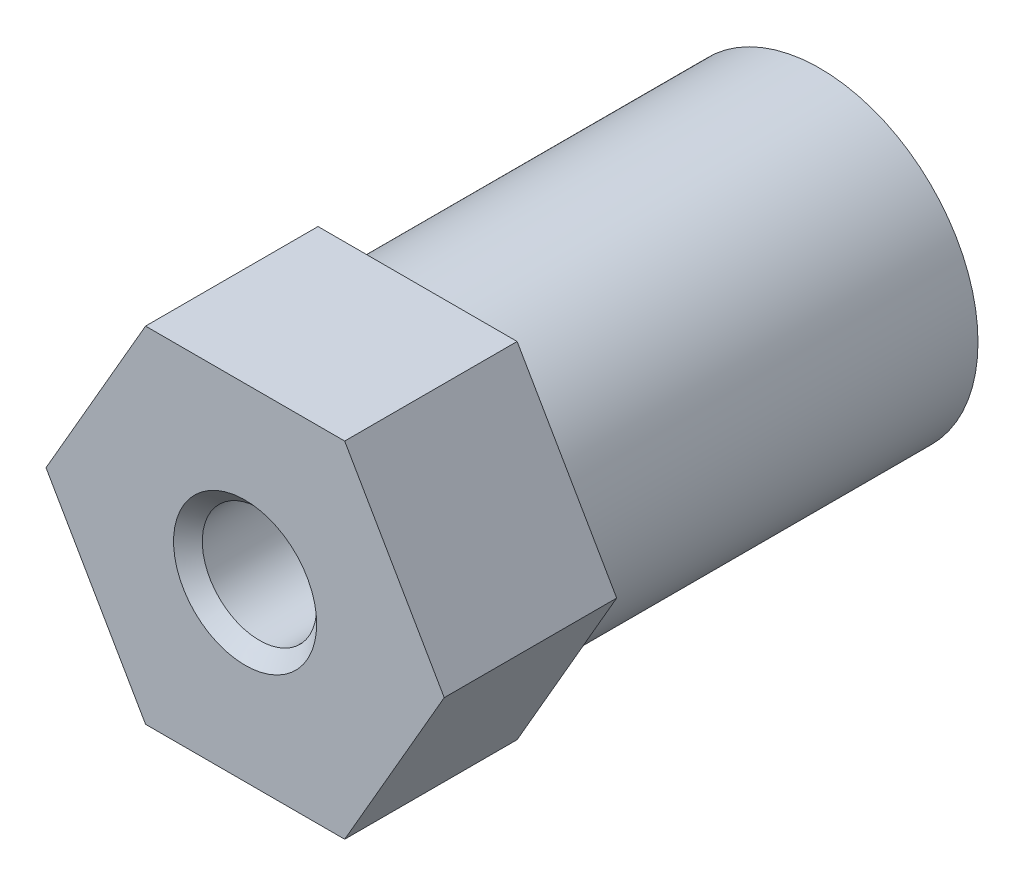
from build123d import *
from build123d.topology import SkipClean

# Parameters (mm, degrees)
SKETCH1_R           = 5.5
BOSS_EXTRUDE1_DEPTH = 14
BOSS_EXTRUDE2_DEPTH = 6
SKETCH3_R           = 1.99
CUT_EXTRUDE1_DEPTH  = 8
CUT_EXTRUDE2_DEPTH  = 12
SKETCH5_R           = 3
CUT_EXTRUDE3_DEPTH  = 1.5
FILLET2_R           = 0.5
CHAMFER1_SIZE       = 0.5


with BuildPart() as part:
    # Sketch1 → Boss-Extrude1 (new body)
    with BuildSketch(Plane.XY):
        Circle(SKETCH1_R)
    extrude(amount=BOSS_EXTRUDE1_DEPTH)

    # Sketch2 → Boss-Extrude2 (add)
    with BuildSketch(Plane.XY.offset(14)):
        Polygon((-6.928203, 0), (-3.464102, -6), (3.464102, -6), (6.928203, 0), (3.464102, 6), (-3.464102, 6), align=None)
    extrude(amount=BOSS_EXTRUDE2_DEPTH)

    # Sketch3 → Cut-Extrude1 (cut)
    with BuildSketch(Plane.XY.offset(20)):
        Circle(SKETCH3_R)
    extrude(amount=-CUT_EXTRUDE1_DEPTH, mode=Mode.SUBTRACT)

    # Sketch4 → Cut-Extrude2 (cut)
    with BuildSketch(Plane(origin=(0, 0, 0), x_dir=(-1, 0, 0), z_dir=(0, 0, -1))):
        with BuildLine():
            Line((-2.236068, 2), (2.236068, 2))
            ThreePointArc((2.236068, 2), (3, 0), (2.236068, -2))
            Line((2.236068, -2), (-2.236068, -2))
            ThreePointArc((-2.236068, -2), (-3, 0), (-2.236068, 2))
        make_face()
    extrude(amount=-CUT_EXTRUDE2_DEPTH, mode=Mode.SUBTRACT)

    # Sketch5 → Cut-Extrude3 (cut)
    with SkipClean():  # the faces are left unmerged after this step: merging them gives an invalid solid
        with BuildSketch(Plane(origin=(0, 0, 0), x_dir=(-1, 0, 0), z_dir=(0, 0, -1))):
            Circle(SKETCH5_R)
        extrude(amount=-CUT_EXTRUDE3_DEPTH, mode=Mode.SUBTRACT)

    # Fillet2
    # the kernel refuses this fillet: 0.5 mm, written as the material it takes off along each edge
    with BuildSketch(Plane(origin=(3.486068, -2, 1.5), x_dir=(0, 0, 1), z_dir=(-1, 0, 0))) as fillet2_piece_1_section:
        with BuildLine():
            CenterArc((FILLET2_R, -FILLET2_R), FILLET2_R, 90, 90)
            Line((0, -FILLET2_R), (0, 0))
            Line((0, 0), (FILLET2_R, 0))
        make_face()
    fillet2_piece_1 = extrude(amount=6.972136, mode=Mode.PRIVATE)
    fillet2_piece_1 = fillet2_piece_1 & Plane(origin=(0, 0, 1.616535), x_dir=(-1, 0, 0), z_dir=(0, 0, -1)) * Cylinder(3, 16, mode=Mode.PRIVATE)
    add(fillet2_piece_1, mode=Mode.SUBTRACT)
    with BuildSketch(Plane(origin=(-3.486068, 2, 1.5), x_dir=(0, 0, 1), z_dir=(1, 0, 0))) as fillet2_piece_2_section:
        with BuildLine():
            CenterArc((FILLET2_R, -FILLET2_R), FILLET2_R, 90, 90)
            Line((0, -FILLET2_R), (0, 0))
            Line((0, 0), (FILLET2_R, 0))
        make_face()
    fillet2_piece_2 = extrude(amount=6.972136, mode=Mode.PRIVATE)
    fillet2_piece_2 = fillet2_piece_2 & Plane(origin=(0, 0, 1.616535), x_dir=(-1, 0, 0), z_dir=(0, 0, -1)) * Cylinder(3, 16, mode=Mode.PRIVATE)
    add(fillet2_piece_2, mode=Mode.SUBTRACT)

    # Chamfer1
    chamfer1_edges = [part.edges().sort_by_distance(p)[0] for p in [
        (-1.99, 0, 20),
    ]]
    chamfer(chamfer1_edges, length=CHAMFER1_SIZE)


solid = part.part
